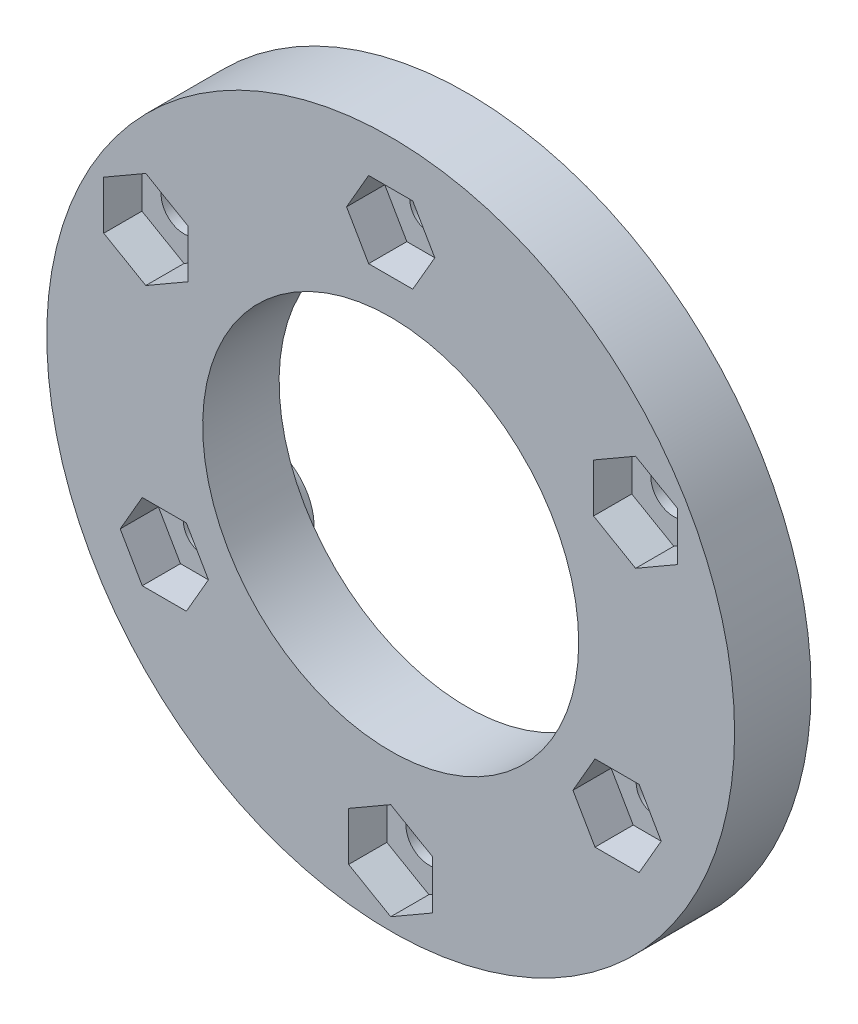
from build123d import *

# Parameters (mm, degrees)
SKETCH2_R                    = 22.5
SKETCH2_R_2                  = 12.3
SKETCH2_R_3                  = 1.25
SKETCH2_R_4                  = 1.5
BOSS_EXTRUDE1_DEPTH          = 5
CUT_EXTRUDE1_DEPTH           = 2.5
CIRPATTERN1_COUNT            = 3
SKETCH4_R                    = 3.3
SKETCH4_R_2                  = 2.5
BOSS_EXTRUDE2_DEPTH          = 1.5
FILLET1_R                    = 1.5
CHAMFER1_SIZE                = 0.25
CIRPATTERN2_COUNT            = 3
FILLET1_OF_CIRPATTERN2_R     = 1.5
CHAMFER1_OF_CIRPATTERN2_SIZE = 0.25


with BuildPart() as part:
    # Sketch2 → Boss-Extrude1 (new body)
    with BuildSketch(Plane.XY):
        Circle(SKETCH2_R)
        Circle(SKETCH2_R_2, mode=Mode.SUBTRACT)
        with Locations((0, 17.1)):
            Circle(SKETCH2_R_3, mode=Mode.SUBTRACT)
        with Locations((14.809034405, -8.55)):
            Circle(SKETCH2_R_3, mode=Mode.SUBTRACT)
        with Locations((16.02146997, 9.25)):
            Circle(SKETCH2_R_4, mode=Mode.SUBTRACT)
        with Locations((0, -18.5)):
            Circle(SKETCH2_R_4, mode=Mode.SUBTRACT)
        with Locations((-14.809034405, -8.55)):
            Circle(SKETCH2_R_3, mode=Mode.SUBTRACT)
        with Locations((-16.02146997, 9.25)):
            Circle(SKETCH2_R_4, mode=Mode.SUBTRACT)
    extrude(amount=BOSS_EXTRUDE1_DEPTH)

    # Sketch3 → Cut-Extrude1 (cut)
    with BuildSketch(Plane.XY.offset(5)):
        Polygon((-2.886751346, 17.1), (-1.443375673, 14.6), (1.443375673, 14.6), (2.886751346, 17.1), (1.443375673, 19.6), (-1.443375673, 19.6), align=None)
        Polygon((16.02146997, 6.074573519), (18.77146997, 7.66228676), (18.77146997, 10.83771324), (16.02146997, 12.425426481), (13.27146997, 10.83771324), (13.27146997, 7.66228676), align=None)
    cut_extrude1 = extrude(amount=-CUT_EXTRUDE1_DEPTH, mode=Mode.SUBTRACT)

    # CirPattern1: Cut-Extrude1 ×3 about axis
    cirpattern1_axis = Axis((0, 0, 0), (0, 0, 1))
    for i in range(1, CIRPATTERN1_COUNT):
        add(cut_extrude1.rotate(cirpattern1_axis, i * 360 / CIRPATTERN1_COUNT), mode=Mode.SUBTRACT)

    # Sketch4 → Boss-Extrude2 (add)
    with BuildSketch(Plane(origin=(0, 0, 0), x_dir=(-1, 0, 0), z_dir=(0, 0, -1))):
        with Locations(Location((0, 17.1, 0), (0, 0, 180))):
            Circle(SKETCH4_R)
        with Locations((0, 17.1)):
            Circle(SKETCH4_R_2, mode=Mode.SUBTRACT)
    boss_extrude2 = extrude(amount=BOSS_EXTRUDE2_DEPTH)

    # Fillet1
    fillet1_edges = [part.edges().sort_by_distance(p)[0] for p in [
        (-3.3, 17.1, 0),
    ]]
    fillet(fillet1_edges, radius=FILLET1_R - 0.0001)  # a hair under: the kernel refuses the full size

    # Chamfer1
    chamfer1_edges = [part.edges().sort_by_distance(p)[0] for p in [
        (2.5, 17.1, -1.5),
    ]]
    chamfer(chamfer1_edges, length=CHAMFER1_SIZE)

    # CirPattern2: Boss-Extrude2 ×3 about axis
    cirpattern2_axis = Axis((0, 0, 0), (0, 0, 1))
    for i in range(1, CIRPATTERN2_COUNT):
        add(boss_extrude2.rotate(cirpattern2_axis, i * 360 / CIRPATTERN2_COUNT))

    # Fillet1 of CirPattern2
    fillet1_of_cirpattern2_edges = [part.edges().sort_by_distance(p)[0] for p in [
        (-13.159034405, -11.407883832, 0),
        (16.459034405, -5.692116168, 0),
    ]]
    fillet(fillet1_of_cirpattern2_edges, radius=FILLET1_OF_CIRPATTERN2_R - 0.0001)  # a hair under: the kernel refuses the full size

    # Chamfer1 of CirPattern2
    chamfer1_of_cirpattern2_edges = [part.edges().sort_by_distance(p)[0] for p in [
        (-16.059034405, -6.384936491, -1.5),
        (13.559034405, -10.715063509, -1.5),
    ]]
    chamfer(chamfer1_of_cirpattern2_edges, length=CHAMFER1_OF_CIRPATTERN2_SIZE)


solid = part.part
